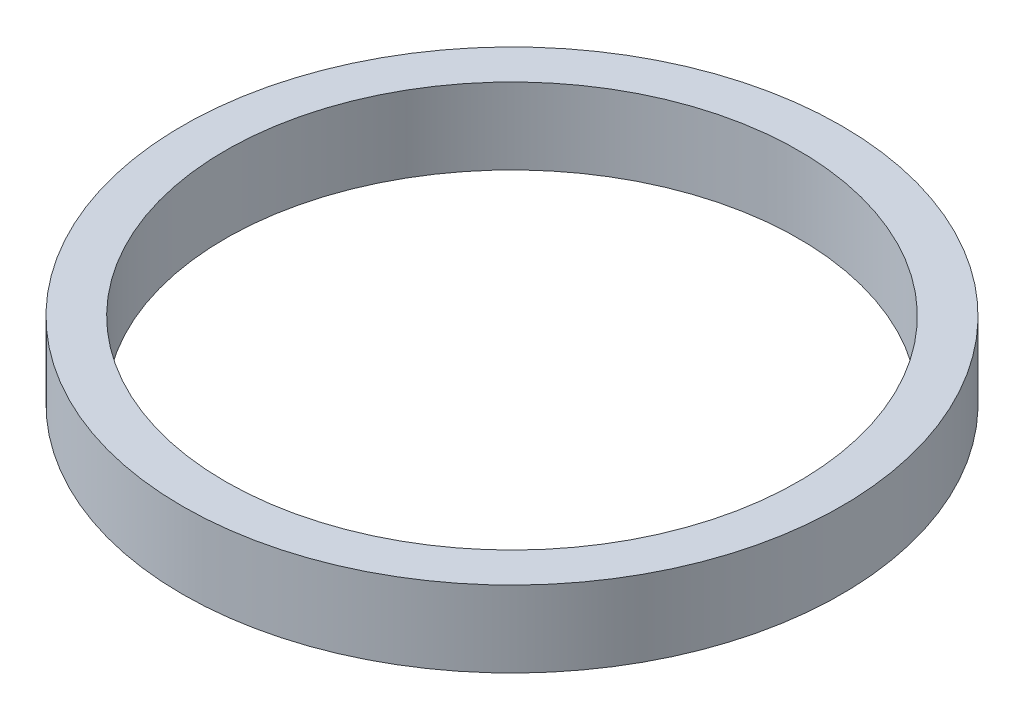
from build123d import *

# Parameters (mm, degrees)
SKETCH1_R           = 129.784214596
SKETCH1_R_2         = 112.883971497
BOSS_EXTRUDE1_DEPTH = 30


with BuildPart() as part:
    # Sketch1 → Boss-Extrude1 (new body)
    with BuildSketch(Plane(origin=(0, 0, 0), x_dir=(1, 0, 0), z_dir=(0, 1, 0))):
        with Locations((-234.756237787, 468.327794117)):
            Circle(SKETCH1_R)
        with Locations((-234.756237787, 468.327794117)):
            Circle(SKETCH1_R_2, mode=Mode.SUBTRACT)
    extrude(amount=BOSS_EXTRUDE1_DEPTH)


solid = part.part
